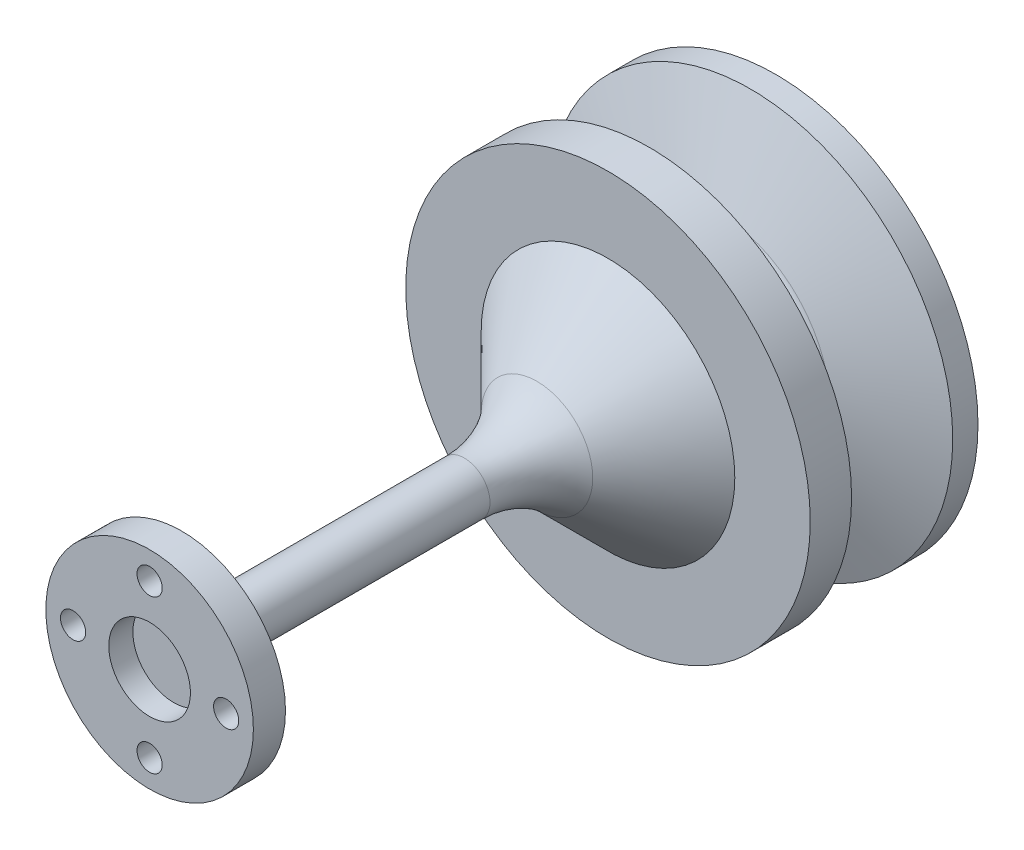
from build123d import *

# Parameters (mm, degrees)
ESQUISSE1_R                  = 20
BOSS_EXTRU_1_DEPTH           = 7.5
CONG_1_R                     = 1.7
CONG_3_R                     = 1.7
ESQUISSE5_R                  = 5
ENL_V_MAT_EXTRU_1_DEPTH      = 33.015621312
ESQUISSE8_R                  = 2.54
BOSS_EXTRU_3_DEPTH           = 43.7388
BOSS_EXTRU_4_START           = 1.5875
ESQUISSE9_R                  = 20
BOSS_EXTRU_4_DEPTH           = 1.5875
ESQUISSE10_R                 = 10.2616
BOSS_EXTRU_5_DEPTH           = 3.175
ENL_V_MAT_EXTRU_3_REACH      = 70.068
ESQUISSE11_R                 = 1.2446
R_P_TITION_CIRCULAIRE2_COUNT = 4
ESQUISSE12_R                 = 4.0386
ENL_V_MAT_EXTRU_4_DEPTH      = 2.38125
CHAMFER1_SIZE                = 10
FILLET1_R                    = 10.16


with BuildPart() as part:
    # Esquisse1 → Boss.-Extru.1 (new, symmetric)
    with BuildSketch(Plane.XY):
        Circle(ESQUISSE1_R)
    extrude(amount=BOSS_EXTRU_1_DEPTH, both=True)

    # Esquisse4 → Enlèvement de matière-Révolution1 (revolve, cut)
    with BuildSketch(Plane(origin=(0, 0, 0), x_dir=(0, 0, -1), z_dir=(1, 0, 0))):
        Polygon((-5, 20), (-1.324936438, 10), (1.324936438, 10), (5, 20), align=None)
    revolve(axis=Axis((0, 0, 15.788572615), (0, 0, -1)), mode=Mode.SUBTRACT)

    # Congé1
    cong_1_edges = [part.edges().sort_by_distance(p)[0] for p in [
        (0, -10, -1.324936438),
    ]]
    fillet(cong_1_edges, radius=CONG_1_R)

    # Congé3
    cong_3_edges = [part.edges().sort_by_distance(p)[0] for p in [
        (0, -10, 1.324936438),
    ]]
    fillet(cong_3_edges, radius=CONG_3_R)

    # Esquisse5 → Enlèv. mat.-Extru.1 (cut, through all)
    with BuildSketch(Plane.XY.offset(7.5)):
        Circle(ESQUISSE5_R)
    extrude(amount=-ENL_V_MAT_EXTRU_1_DEPTH, mode=Mode.SUBTRACT)



with BuildPart() as body_2:
    # Esquisse8 → Boss.-Extru.3 (new body)
    with BuildSketch(Plane.XY.offset(7.5)):
        Circle(ESQUISSE8_R)
    extrude(amount=BOSS_EXTRU_3_DEPTH)


with BuildPart() as part_1:
    add(part.part)

    add(body_2.part)  # Boss.-Extru.4 merges body 2
    # Esquisse9 → Boss.-Extru.4 (add)
    with BuildSketch(Plane.XY.offset(7.5).offset(BOSS_EXTRU_4_START)):
        Circle(ESQUISSE9_R)
    extrude(amount=-BOSS_EXTRU_4_DEPTH)

    # Esquisse10 → Boss.-Extru.5 (add)
    with BuildSketch(Plane.XY.offset(51.2388)):
        Circle(ESQUISSE10_R)
    extrude(amount=BOSS_EXTRU_5_DEPTH)

    # Esquisse11 → Enlèv. mat.-Extru.3 (cut, up to next)
    with BuildSketch(Plane.XY.offset(54.4138), mode=Mode.PRIVATE) as enl_v_mat_extru_3_sk1:
        with Locations((0, 7.5692)):
            Circle(ESQUISSE11_R)
    enl_v_mat_extru_3_tool1 = extrude(enl_v_mat_extru_3_sk1.sketch, amount=-ENL_V_MAT_EXTRU_3_REACH, mode=Mode.PRIVATE) & part_1.part
    enl_v_mat_extru_3 = enl_v_mat_extru_3_tool1.solids().sort_by_distance((0, 7.5692, 54.4138))[0]
    add(enl_v_mat_extru_3, mode=Mode.SUBTRACT)

    # Répétition circulaire2: Enlèv. mat.-Extru.3 ×4 about axis
    r_p_tition_circulaire2_axis = Axis((0, 0, 54.4138), (0, 0, 1))
    for i in range(1, R_P_TITION_CIRCULAIRE2_COUNT):
        add(enl_v_mat_extru_3.rotate(r_p_tition_circulaire2_axis, i * 360 / R_P_TITION_CIRCULAIRE2_COUNT), mode=Mode.SUBTRACT)

    # Esquisse12 → Enlèv. mat.-Extru.4 (cut)
    with BuildSketch(Plane.XY.offset(54.4138)):
        Circle(ESQUISSE12_R)
    extrude(amount=-ENL_V_MAT_EXTRU_4_DEPTH, mode=Mode.SUBTRACT)

    # Chamfer1
    chamfer1_edges = [part_1.edges().sort_by_distance(p)[0] for p in [
        (-2.54, 0, 9.0875),
    ]]
    chamfer(chamfer1_edges, length=CHAMFER1_SIZE)

    # Fillet1
    fillet1_edges = [part_1.edges().sort_by_distance(p)[0] for p in [
        (-2.54, 0, 19.0875),
    ]]
    fillet(fillet1_edges, radius=FILLET1_R)


solid = part_1.part
